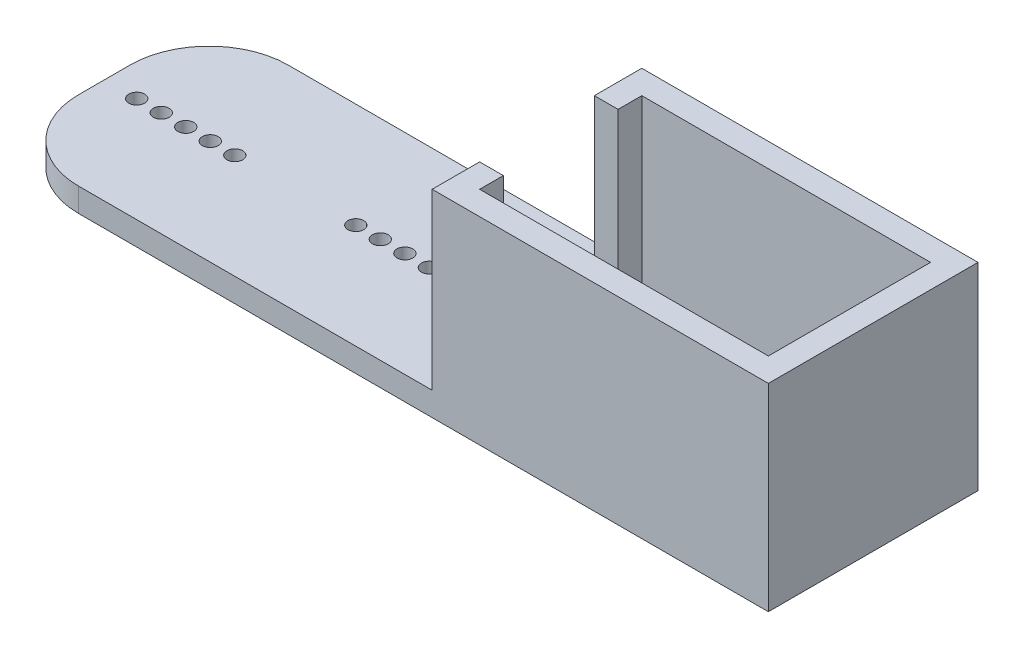
from build123d import *

# Parameters (mm, degrees)
SKETCH1_W           = 97.2
SKETCH1_H           = 26.5
BOSS_EXTRUDE1_DEPTH = 3
BOSS_EXTRUDE2_DEPTH = 22
SKETCH3_W           = 4.5
SKETCH3_H           = 20.5
CUT_EXTRUDE1_DEPTH  = 55.968377273
SKETCH5_R           = 1
CUT_EXTRUDE2_DEPTH  = 55.968377273
FILLET1_R           = 10


with BuildPart() as part:
    # Sketch1 → Boss-Extrude1 (new body)
    with BuildSketch(Plane(origin=(0, 0, 0), x_dir=(1, 0, 0), z_dir=(0, 1, 0))):
        Rectangle(SKETCH1_W, SKETCH1_H)
    extrude(amount=BOSS_EXTRUDE1_DEPTH)

    # Sketch2 → Boss-Extrude2 (add)
    with BuildSketch(Plane(origin=(0, 3, 0), x_dir=(1, 0, 0), z_dir=(0, 1, 0))):
        Polygon((48.6, -13.25), (9.1, -13.25), (6.1, -13.25), (6.1, -7.25), (9.1, -7.25), (9.1, -10.25), (45.6, -10.25), (45.6, 10.25), (9.1, 10.25), (9.1, 7.25), (6.1, 7.25), (6.1, 13.25), (9.6, 13.25), (45.6, 13.25), (48.6, 13.25), align=None)
    extrude(amount=BOSS_EXTRUDE2_DEPTH)

    # Sketch3 → Cut-Extrude1 (cut, through all)
    with BuildSketch(Plane(origin=(0, 3, 0), x_dir=(1, 0, 0), z_dir=(0, 1, 0))):
        with Locations((21.35, 0)):
            Rectangle(SKETCH3_W, SKETCH3_H)
    extrude(amount=-CUT_EXTRUDE1_DEPTH, mode=Mode.SUBTRACT)

    # Sketch5 → Cut-Extrude2 (cut, through all)
    with BuildSketch(Plane(origin=(0, 3, 0), x_dir=(1, 0, 0), z_dir=(0, 1, 0))):
        with Locations((-32.1, 0)):
            Circle(SKETCH5_R)
        with Locations((-16.8, 0)):
            Circle(SKETCH5_R)
        with Locations((-13.7, 0)):
            Circle(SKETCH5_R)
        with Locations((-10.6, 0)):
            Circle(SKETCH5_R)
        with Locations((-7.5, 0)):
            Circle(SKETCH5_R)
        with Locations((-4.4, 0)):
            Circle(SKETCH5_R)
        with Locations((-35.2, 0)):
            Circle(SKETCH5_R)
        with Locations((-38.3, 0)):
            Circle(SKETCH5_R)
        with Locations((-41.4, 0)):
            Circle(SKETCH5_R)
        with Locations((-44.5, 0)):
            Circle(SKETCH5_R)
    extrude(amount=-CUT_EXTRUDE2_DEPTH, mode=Mode.SUBTRACT)

    # Fillet1
    fillet1_edges = [part.edges().sort_by_distance(p)[0] for p in [
        (-48.6, 1.5, -13.25),
        (-48.6, 1.5, 13.25),
    ]]
    fillet(fillet1_edges, radius=FILLET1_R)


solid = part.part
